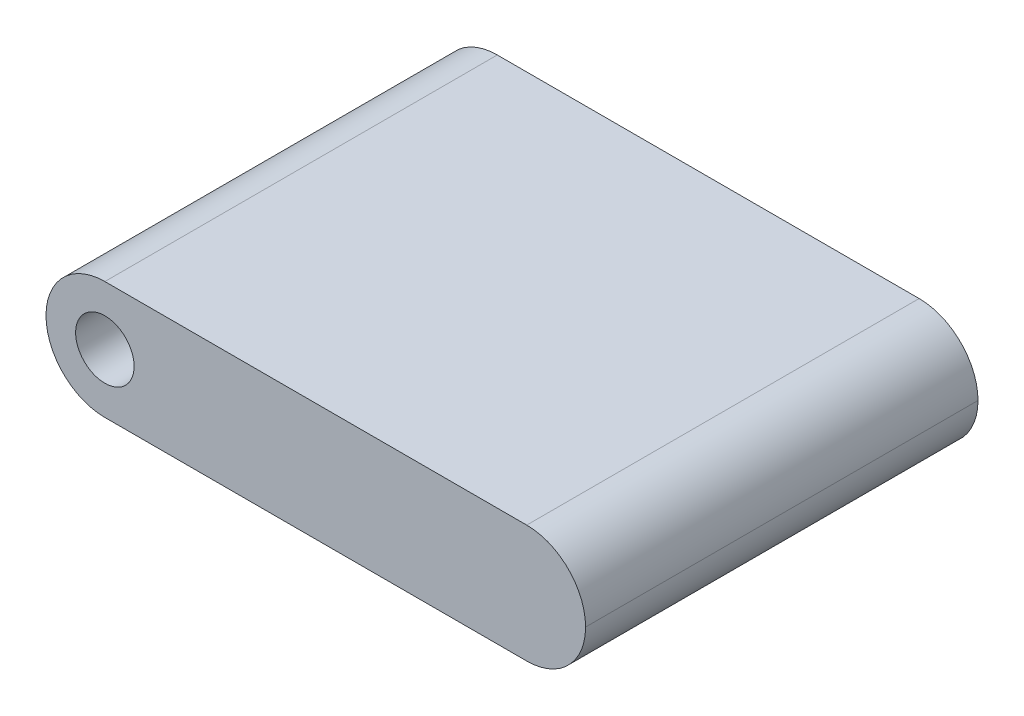
from build123d import *

# Parameters (mm, degrees)
SKETCH1_W           = 55
SKETCH1_H           = 12
SKETCH1_R           = 2.98
BOSS_EXTRUDE1_DEPTH = 20
FILLET2_R           = 6


with BuildPart() as part:
    # Sketch1 → Boss-Extrude1 (new, symmetric)
    with BuildSketch(Plane.XY):
        with Locations((21.5, 0)):
            Rectangle(SKETCH1_W, SKETCH1_H)
        Circle(SKETCH1_R, mode=Mode.SUBTRACT)
    extrude(amount=BOSS_EXTRUDE1_DEPTH, both=True)

    # Fillet2
    fillet2_edges = [part.edges().sort_by_distance(p)[0] for p in [
        (49, -6, 0),
        (49, 6, 0),
        (-6, -6, 0),
        (-6, 6, 0),
    ]]
    fillet(fillet2_edges, radius=FILLET2_R - 0.0001)  # a hair under: the kernel refuses the full size


solid = part.part
